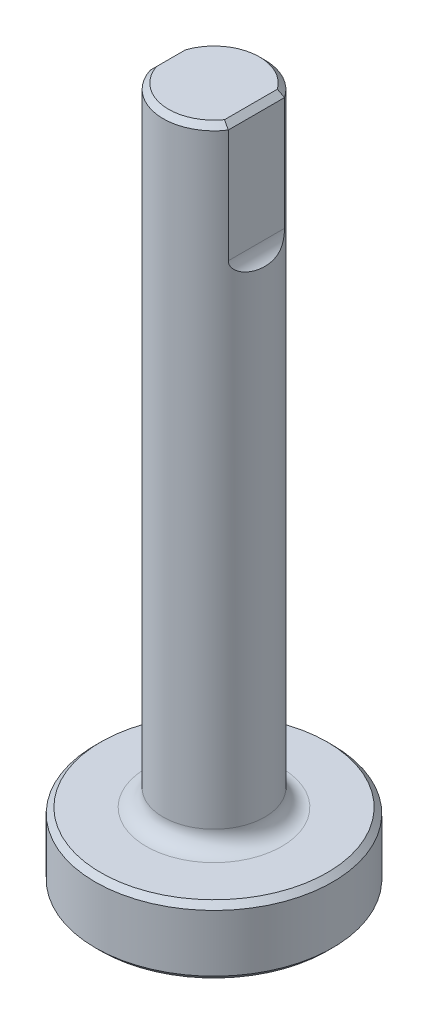
from build123d import *

# Parameters (mm, degrees)
CUT_EXTRUDE1_DEPTH = 6.35
FILLET1_R          = 0.79375
FILLET2_R          = 0.79375
CHAMFER1_SIZE      = 0.254


with BuildPart() as part:
    # Sketch1 → Revolve1 (revolve)
    with BuildSketch(Plane.XY, mode=Mode.PRIVATE) as revolve1_sk:
        Polygon((0, 0), (5.55625, 0), (5.55625, 3.175), (2.38125, 3.175), (2.38125, 32.54375), (0, 32.54375), align=None)
    revolve(revolve1_sk.sketch.rotate(Axis((0, 3.469370861, 0), (0, -1, 0)), 90), axis=Axis((0, 3.469370861, 0), (0, -1, 0)))

    # Sketch4 → Cut-Extrude1 (cut)
    with BuildSketch(Plane(origin=(0, 32.54375, 0), x_dir=(1, 0, 0), z_dir=(0, 1, 0))):
        with BuildLine():
            Line((-2.270399729, -0.71807843), (-2.270399729, 0.71807843))
            ThreePointArc((-2.270399729, 0.71807843), (-2.38125, 0), (-2.270399729, -0.71807843))
        make_face()
        with BuildLine():
            Line((1.984375, -1.316285464), (1.984375, 1.316285464))
            ThreePointArc((1.984375, 1.316285464), (2.38125, 0), (1.984375, -1.316285464))
        make_face()
    extrude(amount=-CUT_EXTRUDE1_DEPTH, mode=Mode.SUBTRACT)

    # Fillet1
    fillet1_edges = [part.edges().sort_by_distance(p)[0] for p in [
        (0, 3.175, -2.38125),
    ]]
    fillet(fillet1_edges, radius=FILLET1_R)

    # Fillet2
    # the kernel refuses this fillet: 0.79375 mm, written as the material it adds along each edge
    with BuildSketch(Plane(origin=(1.984375, 26.19375, 3.300660464), x_dir=(0, 1, 0), z_dir=(0, 0, -1))) as fillet2_piece_1_section:
        with BuildLine():
            CenterArc((FILLET2_R, FILLET2_R), FILLET2_R, 180, 90)
            Line((0, FILLET2_R), (0, 0))
            Line((0, 0), (FILLET2_R, 0))
        make_face()
    fillet2_piece_1 = extrude(amount=6.601320927, mode=Mode.PRIVATE)
    fillet2_piece_1 = fillet2_piece_1 & Plane(origin=(0, 26.406315187, 0), x_dir=(0, 0, 1), z_dir=(0, 1, 0)) * Cylinder(2.38125, 17, mode=Mode.PRIVATE)
    add(fillet2_piece_1)
    with BuildSketch(Plane(origin=(-2.270399729, 26.19375, 2.70245343), x_dir=(0, 1, 0), z_dir=(0, 0, -1))) as fillet2_piece_2_section:
        with BuildLine():
            CenterArc((FILLET2_R, -FILLET2_R), FILLET2_R, 90, 90)
            Line((0, -FILLET2_R), (0, 0))
            Line((0, 0), (FILLET2_R, 0))
        make_face()
    fillet2_piece_2 = extrude(amount=5.404906861, mode=Mode.PRIVATE)
    fillet2_piece_2 = fillet2_piece_2 & Plane(origin=(0, 26.476974143, 0), x_dir=(0, 0, 1), z_dir=(0, 1, 0)) * Cylinder(2.38125, 14, mode=Mode.PRIVATE)
    add(fillet2_piece_2)

    # Chamfer1
    # the kernel refuses this chamfer: 0.254 mm, written as the material it takes off along each edge
    with BuildSketch(Plane(origin=(0, 32.54375, 0), x_dir=(-0.9994949156693064, 0, -0.03177913704312948), z_dir=(-0.03177913704312948, 0, 0.9994949156693064))) as chamfer1_piece_1:
        Polygon((2.38125, CHAMFER1_SIZE), (2.38125 - CHAMFER1_SIZE, 0), (2.38125, 0), align=None)
    revolve(axis=Axis((0, 32.54375, 0), (0, -1, 0)), revolution_arc=160.351494941, mode=Mode.SUBTRACT)
    with BuildSketch(Plane(origin=(0, 32.54375, 0), x_dir=(0, 0, 1), z_dir=(1, 0, 0))) as chamfer1_piece_2:
        Polygon((2.38125, CHAMFER1_SIZE), (2.38125 - CHAMFER1_SIZE, 0), (2.38125, 0), align=None)
    revolve(axis=Axis((0, 32.54375, 0), (0, -1, 0)), revolution_arc=88.170020766, mode=Mode.SUBTRACT)
    with BuildSketch(Plane(origin=(1.984375, 32.54375, 1.969492943), x_dir=(-0.9996219169112972, 0.027495876610573698, 0), z_dir=(0, 0, -1))) as chamfer1_piece_3:
        Polygon((CHAMFER1_SIZE * 0.999621916911, -CHAMFER1_SIZE * 0.0274958766106), (-CHAMFER1_SIZE * 0.0274958766106, -CHAMFER1_SIZE * 0.999621916911), (0, 0), align=None)
    extrude(amount=3.938985885, mode=Mode.SUBTRACT)
    with BuildSketch(Plane(origin=(-2.270399729, 32.54375, 1.371285909), x_dir=(-0.027495876610587867, -0.9996219169112968, 0), z_dir=(0, 0, -1))) as chamfer1_piece_4:
        Polygon((CHAMFER1_SIZE * 0.999621916911, -CHAMFER1_SIZE * 0.0274958766106), (-CHAMFER1_SIZE * 0.0274958766106, -CHAMFER1_SIZE * 0.999621916911), (0, 0), align=None)
    extrude(amount=2.742571819, mode=Mode.SUBTRACT)
    with BuildSketch(Plane(origin=(0, 3.175, 0), x_dir=(0, 0, 1), z_dir=(1, 0, 0))) as chamfer1_piece_5:
        Polygon((5.55625 - CHAMFER1_SIZE, 0), (5.55625, CHAMFER1_SIZE), (5.55625, 0), align=None)
    revolve(axis=Axis((0, 3.175, 0), (0, -1, 0)), mode=Mode.SUBTRACT)
    with BuildSketch(Plane(origin=(0, 0, 0), x_dir=(0, 0, 1), z_dir=(1, 0, 0))) as chamfer1_piece_6:
        Polygon((5.55625, -CHAMFER1_SIZE), (5.55625 - CHAMFER1_SIZE, 0), (5.55625, 0), align=None)
    revolve(axis=Axis((0, 0, 0), (0, -1, 0)), mode=Mode.SUBTRACT)
    with BuildSketch(Plane(origin=(0, 32.54375, 0), x_dir=(0.9519271960907222, 0, 0.3063243596954961), z_dir=(0.3063243596954961, 0, -0.9519271960907222))) as chamfer1_piece_7:
        Polygon((2.38125, CHAMFER1_SIZE), (2.38125 - CHAMFER1_SIZE, 0), (2.38125, 0), align=None)
    revolve(axis=Axis((0, 32.54375, 0), (0, -1, 0)), revolution_arc=72.162141692, mode=Mode.SUBTRACT)


solid = part.part
